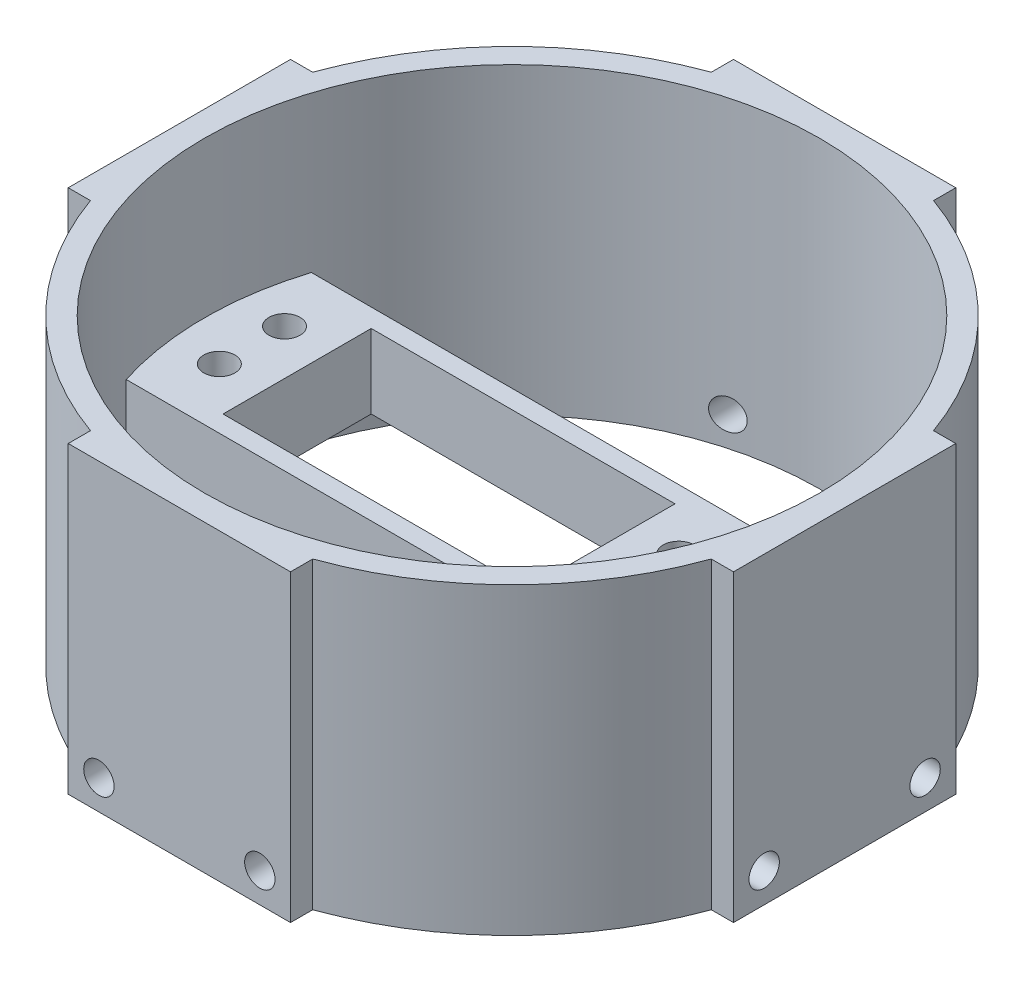
from build123d import *
from build123d.topology import SkipClean

# Parameters (mm, degrees)
SKETCH1_R           = 44.5
SKETCH1_R_2         = 41.5
BOSS_EXTRUDE1_DEPTH = 41
SKETCH2_R           = 2.1
SKETCH2_W           = 41
SKETCH2_H           = 20
BOSS_EXTRUDE2_DEPTH = 20
BOSS_EXTRUDE3_DEPTH = 41
CIRPATTERN1_COUNT   = 4
SKETCH4_R           = 2.05
CUT_EXTRUDE1_DEPTH  = 7
CUT_EXTRUDE2_DEPTH  = 10
CIRPATTERN2_COUNT   = 4


with BuildPart() as part:
    # Sketch1 → Boss-Extrude1 (new body)
    with BuildSketch(Plane(origin=(0, 0, 0), x_dir=(1, 0, 0), z_dir=(0, 1, 0))):
        Circle(SKETCH1_R)
        Circle(SKETCH1_R_2, mode=Mode.SUBTRACT)
    extrude(amount=BOSS_EXTRUDE1_DEPTH)

    # Sketch2 → Boss-Extrude2 (add)
    with BuildSketch(Plane(origin=(0, 0, 0), x_dir=(1, 0, 0), z_dir=(0, 1, 0))):
        with BuildLine():
            Line((-39.572717875, 12.5), (39.572717875, 12.5))
            ThreePointArc((39.572717875, 12.5), (41.658434963, 0), (39.572717875, -12.5))
            Line((39.572717875, -12.5), (-39.572717875, -12.5))
            ThreePointArc((-39.572717875, -12.5), (-41.658434963, 0), (-39.572717875, 12.5))
        make_face()
        with Locations((18.1, 4.4)):
            Circle(SKETCH2_R, mode=Mode.SUBTRACT)
        with Locations((18.1, -4.4)):
            Circle(SKETCH2_R, mode=Mode.SUBTRACT)
        with Locations((-35.1, 4.4)):
            Circle(SKETCH2_R, mode=Mode.SUBTRACT)
        with Locations((-35.1, -4.4)):
            Circle(SKETCH2_R, mode=Mode.SUBTRACT)
        with Locations((-8.5, 0)):
            Rectangle(SKETCH2_W, SKETCH2_H, mode=Mode.SUBTRACT)
    extrude(amount=BOSS_EXTRUDE2_DEPTH)

    # Sketch3 → Boss-Extrude3 (add)
    with BuildSketch(Plane(origin=(0, 0, 0), x_dir=(1, 0, 0), z_dir=(0, 1, 0))):
        with BuildLine():
            Line((0, 44.895703837), (-15, 44.895703837))
            Line((-15, 44.895703837), (-15, 41.895703837))
            ThreePointArc((-15, 41.895703837), (0, 44.5), (15, 41.895703837))
            Line((15, 41.895703837), (15, 44.895703837))
            Line((15, 44.895703837), (0, 44.895703837))
        make_face()
    boss_extrude3 = extrude(amount=BOSS_EXTRUDE3_DEPTH)

    # CirPattern1: Boss-Extrude3 ×4 about axis
    cirpattern1_axis = Axis((0, 41, 0), (0, -1, 0))
    for i in range(1, CIRPATTERN1_COUNT):
        add(boss_extrude3.rotate(cirpattern1_axis, i * 360 / CIRPATTERN1_COUNT))

    # Sketch4 → Cut-Extrude1 (cut)
    with BuildSketch(Plane.ZY.offset(44.895703837)):
        with Locations((10.859802344, 4)):
            Circle(SKETCH4_R)
        with Locations((-10.859802344, 4)):
            Circle(SKETCH4_R)
    cut_extrude1 = extrude(amount=-CUT_EXTRUDE1_DEPTH, mode=Mode.SUBTRACT)

    # Sketch5 → Cut-Extrude2 (cut)
    with SkipClean():  # the faces are left unmerged after this step: merging them gives an invalid solid
        with BuildSketch(Plane(origin=(0, 0, 0), x_dir=(1, 0, 0), z_dir=(0, 1, 0))):
            with BuildLine():
                Line((-39.572717875, 12.5), (39.572717875, 12.5))
                ThreePointArc((39.572717875, 12.5), (41.5, 0), (39.572717875, -12.5))
                Line((39.572717875, -12.5), (-39.572717875, -12.5))
                ThreePointArc((-39.572717875, -12.5), (-41.5, 0), (-39.572717875, 12.5))
            make_face()
        extrude(amount=CUT_EXTRUDE2_DEPTH, mode=Mode.SUBTRACT)

    # CirPattern2: Cut-Extrude1 ×4 about axis
    with SkipClean():  # the faces are left unmerged after this step: merging them gives an invalid solid
        cirpattern2_axis = Axis((0, 41, 0), (0, -1, 0))
        for i in range(1, CIRPATTERN2_COUNT):
            add(cut_extrude1.rotate(cirpattern2_axis, i * 360 / CIRPATTERN2_COUNT), mode=Mode.SUBTRACT)


solid = part.part
